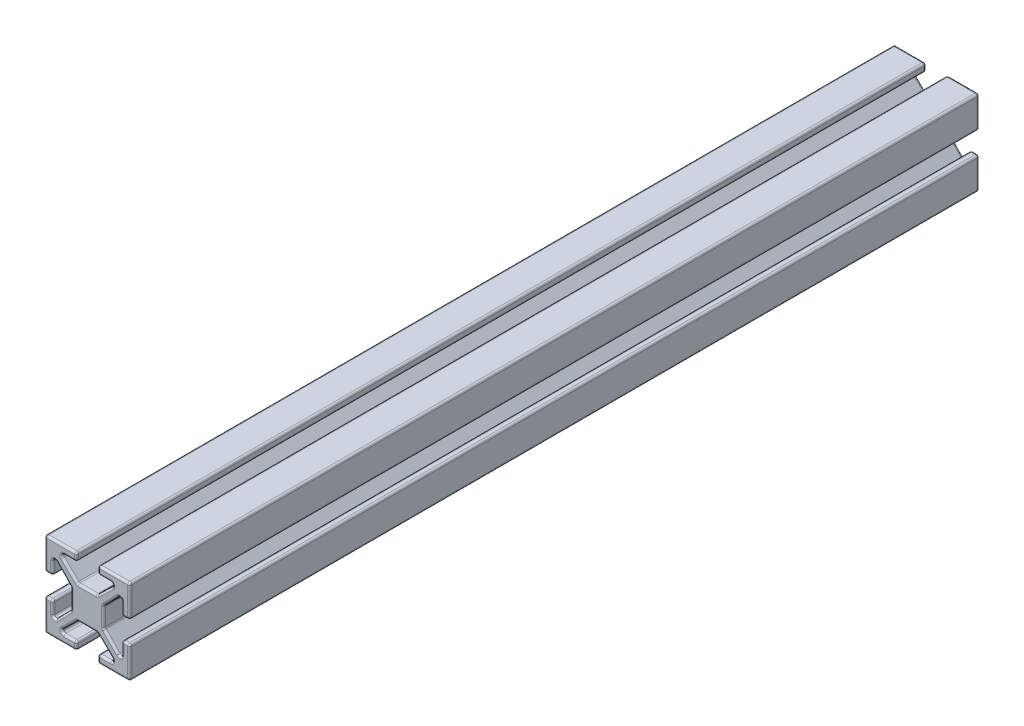
from build123d import *

# Parameters (mm, degrees)
BOSS_EXTRUDE1_DEPTH = 400
FILLET3_R           = 1


with BuildPart() as part:
    # Sketch1 → Boss-Extrude1 (new body)
    with BuildSketch(Plane.XY):
        Polygon((-5, 16.212568099), (-5, 20), (-20, 20), (-20, 5), (-16.212568099, 5), (-16.212568099, 13.432263719), (-7.689389441, 4.631155322), (-7.689389441, 0), (-7.689389441, -4.631155322), (-16.212568099, -13.432263719), (-16.212568099, -5), (-20, -5), (-20, -20), (-5, -20), (-5, -16.212568099), (-13.432263719, -16.212568099), (-4.631155322, -7.689389441), (0, -7.689389441), (4.631155322, -7.689389441), (13.432263719, -16.212568099), (5, -16.212568099), (5, -20), (20, -20), (20, -5), (16.212568099, -5), (16.212568099, -13.432263719), (7.689389441, -4.631155322), (7.689389441, 0), (7.689389441, 4.631155322), (16.212568099, 13.432263719), (16.212568099, 5), (20, 5), (20, 20), (5, 20), (5, 16.212568099), (13.432263719, 16.212568099), (4.631155322, 7.689389441), (0, 7.689389441), (-4.631155322, 7.689389441), (-13.432263719, 16.212568099), align=None)
    extrude(amount=BOSS_EXTRUDE1_DEPTH)

    # Fillet3
    fillet3_edges = [part.edges().sort_by_distance(p)[0] for p in [
        (-9.03170952, -11.95097877, 0),
        (0, -7.689389441, 0),
        (9.031709521, -11.95097877, 0),
        (9.216131859, -16.212568099, 0),
        (5, -18.10628405, 0),
        (12.5, -20, 0),
        (20, -12.5, 0),
        (18.10628405, -5, 0),
        (16.212568099, -9.216131859, 0),
        (11.95097877, -9.03170952, 0),
        (7.689389441, 0, 0),
        (11.95097877, 9.03170952, 0),
        (16.212568099, 9.216131859, 0),
        (18.10628405, 5, 0),
        (20, 12.5, 0),
        (5, 18.10628405, 0),
        (9.216131859, 16.212568099, 0),
        (9.03170952, 11.95097877, 0),
        (0, 7.689389441, 0),
        (-9.03170952, 11.95097877, 0),
        (-9.216131859, 16.212568099, 0),
        (-5, 18.10628405, 0),
        (-12.5, 20, 0),
        (-20, 12.5, 0),
        (-18.10628405, 5, 0),
        (-16.212568099, 9.216131859, 0),
        (-11.95097877, 9.03170952, 0),
        (-7.689389441, 0, 0),
        (-11.95097877, -9.03170952, 0),
        (-16.212568099, -9.216131859, 0),
        (-18.10628405, -5, 0),
        (-20, -12.5, 0),
        (-12.5, -20, 0),
        (-5, -18.10628405, 0),
        (-9.216131859, -16.212568099, 0),
        (-9.03170952, -11.95097877, 400),
        (0, -7.689389441, 400),
        (9.031709521, -11.95097877, 400),
        (9.216131859, -16.212568099, 400),
        (5, -18.10628405, 400),
        (12.5, -20, 400),
        (20, -12.5, 400),
        (18.10628405, -5, 400),
        (16.212568099, -9.216131859, 400),
        (11.95097877, -9.03170952, 400),
        (7.689389441, 0, 400),
        (11.95097877, 9.03170952, 400),
        (16.212568099, 9.216131859, 400),
        (18.10628405, 5, 400),
        (20, 12.5, 400),
        (12.5, 20, 400),
        (5, 18.10628405, 400),
        (9.216131859, 16.212568099, 400),
        (9.03170952, 11.95097877, 400),
        (0, 7.689389441, 400),
        (-9.03170952, 11.95097877, 400),
        (-9.216131859, 16.212568099, 400),
        (-5, 18.10628405, 400),
        (-12.5, 20, 400),
        (-20, 12.5, 400),
        (-18.10628405, 5, 400),
        (-16.212568099, 9.216131859, 400),
        (-11.95097877, 9.03170952, 400),
        (-7.689389441, 0, 400),
        (-11.95097877, -9.03170952, 400),
        (-16.212568099, -9.216131859, 400),
        (-18.10628405, -5, 400),
        (-20, -12.5, 400),
        (-12.5, -20, 400),
        (-5, -18.10628405, 400),
        (-9.216131859, -16.212568099, 400),
        (-13.432263719, -16.212568099, 200),
        (-5, -16.212568099, 200),
        (-5, -20, 200),
        (-20, -20, 200),
        (-20, -5, 200),
        (-16.212568099, -5, 200),
        (-16.212568099, -13.432263719, 200),
        (-7.689389441, -4.631155322, 200),
        (-7.689389441, 4.631155322, 200),
        (-16.212568099, 13.432263719, 200),
        (-16.212568099, 5, 200),
        (-20, 5, 200),
        (-20, 20, 200),
        (-5, 20, 200),
        (-5, 16.212568099, 200),
        (-13.432263719, 16.212568099, 200),
        (-4.631155322, 7.689389441, 200),
        (4.631155322, 7.689389441, 200),
        (13.432263719, 16.212568099, 200),
        (5, 16.212568099, 200),
        (5, 20, 200),
        (20, 20, 200),
        (20, 5, 200),
        (16.212568099, 5, 200),
        (16.212568099, 13.432263719, 200),
        (7.689389441, 4.631155322, 200),
        (7.689389441, -4.631155322, 200),
        (16.212568099, -13.432263719, 200),
        (16.212568099, -5, 200),
        (20, -5, 200),
        (20, -20, 200),
        (5, -20, 200),
        (5, -16.212568099, 200),
        (13.432263719, -16.212568099, 200),
        (4.631155322, -7.689389441, 200),
        (-4.631155322, -7.689389441, 200),
        (12.5, 20, 0),
    ]]
    fillet(fillet3_edges, radius=FILLET3_R)


solid = part.part
